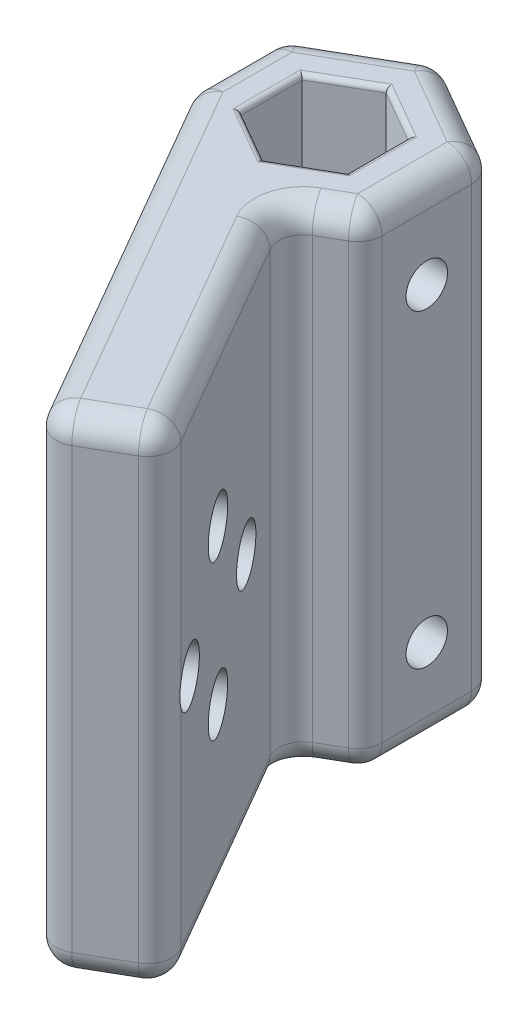
from build123d import *

# Parameters (mm, degrees)
BOSS_EXTRUDE1_DEPTH            = 30
CBORE_FOR_M3_SHCS1_D           = 3.4
CBORE_FOR_M3_SHCS1_CBORE_D     = 6.5
CBORE_FOR_M3_SHCS1_CBORE_DEPTH = 3
F_10_CLEARANCE_HOLE1_D         = 5.1054
FILLET1_R                      = 3
FILLET2_R                      = 0.6


with BuildPart() as part:
    # Sketch1 → Boss-Extrude1 (new, symmetric)
    with BuildSketch(Plane(origin=(0, 0, 0), x_dir=(1, 0, 0), z_dir=(0, 1, 0))):
        Polygon((-4.775, -17.248339292), (13.225, -48.425253828), (23.617304845, -42.425253828), (5.617304845, -11.248339292), (12.55, -7.245745878), (12.55, 7.245745878), (0, 14.491491757), (-12.55, 7.245745878), (-12.55, -3.781644263), align=None)
        Polygon((6.55, -3.781644263), (6.55, 3.781644263), (0, 7.563288526), (-6.55, 3.781644263), (-6.55, -3.781644263), (0, -7.563288526), align=None, mode=Mode.SUBTRACT)
    extrude(amount=BOSS_EXTRUDE1_DEPTH, both=True)

    # CBORE for M3 SHCS1 (through all)
    with Locations(Plane(origin=(-0.657695155, 0, 0.379720475), x_dir=(-0.5000000000000012, 0, -0.866025403784438), z_dir=(0.8660254037844379, 0, -0.5000000000000011))):
        with Locations((-33.05, 9.5), (-42.55, 0), (-23.55, 0), (-33.05, -9.5)):
            CounterBoreHole(CBORE_FOR_M3_SHCS1_D / 2, CBORE_FOR_M3_SHCS1_CBORE_D / 2, CBORE_FOR_M3_SHCS1_CBORE_DEPTH)

    # #10 Clearance Hole1 (through all)
    with Locations(Plane(origin=(12.55, 0, 0), x_dir=(0, 0, -1), z_dir=(1, 0, 0))):
        with Locations((0, -19.05), (0, 19.05)):
            Hole(F_10_CLEARANCE_HOLE1_D / 2)

    # Fillet1
    # the kernel refuses this fillet: 3 mm, written as the material it adds along each edge
    with BuildSketch(Plane(origin=(5.617304845, -30, 11.248339292), x_dir=(0.5000000000000009, 0, 0.8660254037844382), z_dir=(0, 1, 0))) as fillet1_piece_1:
        with BuildLine():
            CenterArc((FILLET1_R, FILLET1_R), FILLET1_R, 180, 90)
            Line((0, FILLET1_R), (0, 0))
            Line((0, 0), (FILLET1_R, 0))
        make_face()
    extrude(amount=60)
    # the kernel refuses this fillet: 3 mm, written as the material it takes off along each edge
    with BuildSketch(Plane(origin=(-9.55, -27, -5.513695071), x_dir=(-1, 0, 0), z_dir=(0, -1, 0))) as fillet1_2_piece_1_section:
        Polygon((0, 0), (FILLET1_R, 0), (FILLET1_R, FILLET1_R * 0.57735026919), (FILLET1_R * 0.5, FILLET1_R * 0.866025403784), align=None)
    fillet1_2_piece_1 = extrude(amount=FILLET1_R, mode=Mode.PRIVATE)
    fillet1_2_piece_1 = fillet1_2_piece_1 - Plane(origin=(-9.55, -27, -5.513695071), x_dir=(0.8660254037844387, 0, 0.5000000000000001), z_dir=(0, -1, 0)) * Sphere(FILLET1_R, mode=Mode.PRIVATE)
    add(fillet1_2_piece_1, mode=Mode.SUBTRACT)
    with BuildSketch(Plane(origin=(-9.55, -27, 2.977796686), x_dir=(-1, 0, 0), z_dir=(0, -1, 0))) as fillet1_2_piece_2_section:
        Polygon((0, 0), (FILLET1_R, 0), (FILLET1_R, -FILLET1_R * 0.267949192431), (FILLET1_R * 0.866025403784, -FILLET1_R * 0.5), align=None)
    fillet1_2_piece_2 = extrude(amount=FILLET1_R, mode=Mode.PRIVATE)
    fillet1_2_piece_2 = fillet1_2_piece_2 - Plane(origin=(-9.55, -27, 2.977796686), x_dir=(0.9659258262890681, 0, -0.25881904510252146), z_dir=(0, -1, 0)) * Sphere(FILLET1_R, mode=Mode.PRIVATE)
    add(fillet1_2_piece_2, mode=Mode.SUBTRACT)
    with BuildSketch(Plane(origin=(0, -27, -11.027390142), x_dir=(0.5000000000000001, 0, -0.8660254037844387), z_dir=(0, -1, 0))) as fillet1_2_piece_3_section:
        Polygon((0, 0), (FILLET1_R, 0), (FILLET1_R, -FILLET1_R * 0.57735026919), (FILLET1_R * 0.5, -FILLET1_R * 0.866025403784), align=None)
    fillet1_2_piece_3 = extrude(amount=FILLET1_R, mode=Mode.PRIVATE)
    fillet1_2_piece_3 = fillet1_2_piece_3 - Plane(origin=(0, -27, -11.027390142), x_dir=(0, 0, 1), z_dir=(0, -1, 0)) * Sphere(FILLET1_R, mode=Mode.PRIVATE)
    add(fillet1_2_piece_3, mode=Mode.SUBTRACT)
    with BuildSketch(Plane(origin=(9.55, -27, -5.513695071), x_dir=(1, 0, 0), z_dir=(0, -1, 0))) as fillet1_2_piece_4_section:
        Polygon((0, 0), (FILLET1_R, 0), (FILLET1_R, -FILLET1_R * 0.57735026919), (FILLET1_R * 0.5, -FILLET1_R * 0.866025403784), align=None)
    fillet1_2_piece_4 = extrude(amount=FILLET1_R, mode=Mode.PRIVATE)
    fillet1_2_piece_4 = fillet1_2_piece_4 - Plane(origin=(9.55, -27, -5.513695071), x_dir=(-0.8660254037844387, 0, 0.5000000000000001), z_dir=(0, -1, 0)) * Sphere(FILLET1_R, mode=Mode.PRIVATE)
    add(fillet1_2_piece_4, mode=Mode.SUBTRACT)
    with BuildSketch(Plane(origin=(9.55, -27, 5.513695071), x_dir=(1, 0, 0), z_dir=(0, -1, 0))) as fillet1_2_piece_5_section:
        Polygon((0, 0), (FILLET1_R, 0), (FILLET1_R, FILLET1_R * 0.57735026919), (FILLET1_R * 0.5, FILLET1_R * 0.866025403784), align=None)
    fillet1_2_piece_5 = extrude(amount=FILLET1_R, mode=Mode.PRIVATE)
    fillet1_2_piece_5 = fillet1_2_piece_5 - Plane(origin=(9.55, -27, 5.513695071), x_dir=(-0.8660254037844387, 0, -0.5000000000000001), z_dir=(0, -1, 0)) * Sphere(FILLET1_R, mode=Mode.PRIVATE)
    add(fillet1_2_piece_5, mode=Mode.SUBTRACT)
    with BuildSketch(Plane(origin=(19.519228634, -27, 41.327177617), x_dir=(0, -1, 0), z_dir=(0.866025403784438, 0, -0.5000000000000012))) as fillet1_2_piece_6_section:
        Polygon((0, 0), (FILLET1_R, 0), (FILLET1_R, -FILLET1_R), (0, -FILLET1_R), align=None)
    fillet1_2_piece_6 = extrude(amount=FILLET1_R, mode=Mode.PRIVATE)
    fillet1_2_piece_6 = fillet1_2_piece_6 - Plane(origin=(19.519228634, -27, 41.327177617), x_dir=(-0.3535533905932746, 0.7071067811865475, -0.612372435695794), z_dir=(0.866025403784438, 0, -0.5000000000000012)) * Sphere(FILLET1_R, mode=Mode.PRIVATE)
    add(fillet1_2_piece_6, mode=Mode.SUBTRACT)
    with BuildSketch(Plane(origin=(14.323076211, -27, 44.327177617), x_dir=(0.5000000000000012, 0, 0.866025403784438), z_dir=(-0.8660254037844379, 0, 0.5000000000000012))) as fillet1_2_piece_7_section:
        Polygon((0, 0), (FILLET1_R, 0), (FILLET1_R, -FILLET1_R), (0, -FILLET1_R), align=None)
    fillet1_2_piece_7 = extrude(amount=FILLET1_R, mode=Mode.PRIVATE)
    fillet1_2_piece_7 = fillet1_2_piece_7 - Plane(origin=(14.323076211, -27, 44.327177617), x_dir=(-0.3535533905932746, 0.7071067811865475, -0.612372435695794), z_dir=(-0.8660254037844379, 0, 0.5000000000000012)) * Sphere(FILLET1_R, mode=Mode.PRIVATE)
    add(fillet1_2_piece_7, mode=Mode.SUBTRACT)
    with BuildSketch(Plane(origin=(9.55, 27, 5.513695071), x_dir=(1, 0, 0), z_dir=(0, 1, 0))) as fillet1_2_piece_8_section:
        Polygon((0, 0), (FILLET1_R, 0), (FILLET1_R, -FILLET1_R * 0.57735026919), (FILLET1_R * 0.5, -FILLET1_R * 0.866025403784), align=None)
    fillet1_2_piece_8 = extrude(amount=FILLET1_R, mode=Mode.PRIVATE)
    fillet1_2_piece_8 = fillet1_2_piece_8 - Plane(origin=(9.55, 27, 5.513695071), x_dir=(-0.8660254037844387, 0, -0.5000000000000001), z_dir=(0, 1, 0)) * Sphere(FILLET1_R, mode=Mode.PRIVATE)
    add(fillet1_2_piece_8, mode=Mode.SUBTRACT)
    with BuildSketch(Plane(origin=(14.323076211, 27, 44.327177617), x_dir=(0.5000000000000012, 0, 0.866025403784438), z_dir=(-0.8660254037844379, 0, 0.5000000000000012))) as fillet1_2_piece_9_section:
        Polygon((0, 0), (FILLET1_R, 0), (FILLET1_R, FILLET1_R), (0, FILLET1_R), align=None)
    fillet1_2_piece_9 = extrude(amount=FILLET1_R, mode=Mode.PRIVATE)
    fillet1_2_piece_9 = fillet1_2_piece_9 - Plane(origin=(14.323076211, 27, 44.327177617), x_dir=(-0.3535533905932746, -0.7071067811865475, -0.612372435695794), z_dir=(-0.8660254037844379, 0, 0.5000000000000012)) * Sphere(FILLET1_R, mode=Mode.PRIVATE)
    add(fillet1_2_piece_9, mode=Mode.SUBTRACT)
    with BuildSketch(Plane(origin=(-9.55, 27, 2.977796686), x_dir=(-1, 0, 0), z_dir=(0, 1, 0))) as fillet1_2_piece_10_section:
        Polygon((0, 0), (FILLET1_R, 0), (FILLET1_R, FILLET1_R * 0.267949192431), (FILLET1_R * 0.866025403784, FILLET1_R * 0.5), align=None)
    fillet1_2_piece_10 = extrude(amount=FILLET1_R, mode=Mode.PRIVATE)
    fillet1_2_piece_10 = fillet1_2_piece_10 - Plane(origin=(-9.55, 27, 2.977796686), x_dir=(0.9659258262890681, 0, -0.25881904510252146), z_dir=(0, 1, 0)) * Sphere(FILLET1_R, mode=Mode.PRIVATE)
    add(fillet1_2_piece_10, mode=Mode.SUBTRACT)
    with BuildSketch(Plane(origin=(-9.55, 27, -5.513695071), x_dir=(-1, 0, 0), z_dir=(0, 1, 0))) as fillet1_2_piece_11_section:
        Polygon((0, 0), (FILLET1_R, 0), (FILLET1_R, -FILLET1_R * 0.57735026919), (FILLET1_R * 0.5, -FILLET1_R * 0.866025403784), align=None)
    fillet1_2_piece_11 = extrude(amount=FILLET1_R, mode=Mode.PRIVATE)
    fillet1_2_piece_11 = fillet1_2_piece_11 - Plane(origin=(-9.55, 27, -5.513695071), x_dir=(0.8660254037844387, 0, 0.5000000000000001), z_dir=(0, 1, 0)) * Sphere(FILLET1_R, mode=Mode.PRIVATE)
    add(fillet1_2_piece_11, mode=Mode.SUBTRACT)
    with BuildSketch(Plane(origin=(0, 27, -11.027390142), x_dir=(0.5000000000000001, 0, -0.8660254037844387), z_dir=(0, 1, 0))) as fillet1_2_piece_12_section:
        Polygon((0, 0), (FILLET1_R, 0), (FILLET1_R, FILLET1_R * 0.57735026919), (FILLET1_R * 0.5, FILLET1_R * 0.866025403784), align=None)
    fillet1_2_piece_12 = extrude(amount=FILLET1_R, mode=Mode.PRIVATE)
    fillet1_2_piece_12 = fillet1_2_piece_12 - Plane(origin=(0, 27, -11.027390142), x_dir=(0, 0, 1), z_dir=(0, 1, 0)) * Sphere(FILLET1_R, mode=Mode.PRIVATE)
    add(fillet1_2_piece_12, mode=Mode.SUBTRACT)
    with BuildSketch(Plane(origin=(9.55, 27, -5.513695071), x_dir=(1, 0, 0), z_dir=(0, 1, 0))) as fillet1_2_piece_13_section:
        Polygon((0, 0), (FILLET1_R, 0), (FILLET1_R, FILLET1_R * 0.57735026919), (FILLET1_R * 0.5, FILLET1_R * 0.866025403784), align=None)
    fillet1_2_piece_13 = extrude(amount=FILLET1_R, mode=Mode.PRIVATE)
    fillet1_2_piece_13 = fillet1_2_piece_13 - Plane(origin=(9.55, 27, -5.513695071), x_dir=(-0.8660254037844387, 0, 0.5000000000000001), z_dir=(0, 1, 0)) * Sphere(FILLET1_R, mode=Mode.PRIVATE)
    add(fillet1_2_piece_13, mode=Mode.SUBTRACT)
    with BuildSketch(Plane(origin=(19.519228634, 27, 41.327177617), x_dir=(0, 1, 0), z_dir=(0.5000000000000012, 0, 0.866025403784438))) as fillet1_2_piece_14_section:
        Polygon((0, 0), (FILLET1_R, 0), (FILLET1_R, -FILLET1_R), (0, -FILLET1_R), align=None)
    fillet1_2_piece_14 = extrude(amount=FILLET1_R, mode=Mode.PRIVATE)
    fillet1_2_piece_14 = fillet1_2_piece_14 - Plane(origin=(19.519228634, 27, 41.327177617), x_dir=(-0.612372435695794, -0.7071067811865475, 0.3535533905932746), z_dir=(0.5000000000000012, 0, 0.866025403784438)) * Sphere(FILLET1_R, mode=Mode.PRIVATE)
    add(fillet1_2_piece_14, mode=Mode.SUBTRACT)
    with BuildSketch(Plane(origin=(-12.55, -30, -5.513695071), x_dir=(1, 0, 0), z_dir=(0, 0, 1))) as fillet1_2_piece_15:
        with BuildLine():
            CenterArc((FILLET1_R, FILLET1_R), FILLET1_R, 180, 90)
            Line((0, FILLET1_R), (0, 0))
            Line((0, 0), (FILLET1_R, 0))
        make_face()
    extrude(amount=8.491491757, mode=Mode.SUBTRACT)
    with BuildSketch(Plane(origin=(-1.5, -30, -13.625466353), x_dir=(0.5000000000000001, 0, 0.8660254037844386), z_dir=(-0.8660254037844387, 0, 0.5000000000000001)), Plane(origin=(11.05, -30, -8.111771282), x_dir=(-0.5, 0, 0.8660254037844386), z_dir=(-0.8660254037844387, 0, -0.5000000000000001)), Plane(origin=(12.55, -30, 5.513695071), x_dir=(-1, 0, 0), z_dir=(0, 0, -1))) as fillet1_2_piece_16:
        with BuildLine():
            CenterArc((FILLET1_R, FILLET1_R), FILLET1_R, 180, 90)
            Line((0, FILLET1_R), (0, 0))
            Line((0, 0), (FILLET1_R, 0))
        make_face()
    extrude(amount=11.027390142, mode=Mode.SUBTRACT)
    with BuildSketch(Plane(origin=(8.215381057, -30, 9.748339292), x_dir=(-0.5, 0, -0.8660254037844386), z_dir=(0.8660254037844387, 0, -0.5000000000000001))) as fillet1_2_piece_17:
        with BuildLine():
            CenterArc((FILLET1_R, FILLET1_R), FILLET1_R, 180, 90)
            Line((0, FILLET1_R), (0, 0))
            Line((0, 0), (FILLET1_R, 0))
        make_face()
    extrude(amount=3.27313602, mode=Mode.SUBTRACT)
    with BuildSketch(Plane(origin=(22.117304845, -30, 39.827177617), x_dir=(-0.8660254037844379, 0, 0.5000000000000012), z_dir=(-0.5000000000000012, 0, -0.866025403784438))) as fillet1_2_piece_18:
        with BuildLine():
            CenterArc((FILLET1_R, FILLET1_R), FILLET1_R, 180, 90)
            Line((0, FILLET1_R), (0, 0))
            Line((0, 0), (FILLET1_R, 0))
        make_face()
    extrude(amount=30, mode=Mode.SUBTRACT)
    with BuildSketch(Plane(origin=(15.823076211, -30, 46.925253828), x_dir=(0, 1, 0), z_dir=(0.866025403784438, 0, -0.5000000000000012))) as fillet1_2_piece_19:
        with BuildLine():
            CenterArc((FILLET1_R, -FILLET1_R), FILLET1_R, 90, 90)
            Line((0, -FILLET1_R), (0, 0))
            Line((0, 0), (FILLET1_R, 0))
        make_face()
    extrude(amount=6, mode=Mode.SUBTRACT)
    with BuildSketch(Plane(origin=(8.215381057, 30, 9.748339292), x_dir=(-0.5, 0, -0.8660254037844386), z_dir=(0.8660254037844387, 0, -0.5000000000000001))) as fillet1_2_piece_20:
        with BuildLine():
            CenterArc((FILLET1_R, -FILLET1_R), FILLET1_R, 90, 90)
            Line((0, -FILLET1_R), (0, 0))
            Line((0, 0), (FILLET1_R, 0))
        make_face()
    extrude(amount=3.27313602, mode=Mode.SUBTRACT)
    with BuildSketch(Plane(origin=(13.225, -27, 48.425253828), x_dir=(-0.5000000000000022, 0, -0.8660254037844374), z_dir=(0, 1, 0)), Plane(origin=(23.617304845, -27, 42.425253828), x_dir=(-0.8660254037844379, 0, 0.500000000000001), z_dir=(0, 1, 0))) as fillet1_2_piece_21:
        with BuildLine():
            CenterArc((FILLET1_R, -FILLET1_R), FILLET1_R, 90, 90)
            Line((0, -FILLET1_R), (0, 0))
            Line((0, 0), (FILLET1_R, 0))
        make_face()
    extrude(amount=54, mode=Mode.SUBTRACT)
    with BuildSketch(Plane(origin=(-12.55, 27, 3.781644263), x_dir=(0.49999999999999556, 0, 0.8660254037844412), z_dir=(0, -1, 0))) as fillet1_2_piece_22:
        with BuildLine():
            CenterArc((FILLET1_R * 0.267949192431, -FILLET1_R), FILLET1_R, 90, 30)
            Line((-FILLET1_R * 0.232050807569, -FILLET1_R * 0.133974596216), (0, 0))
            Line((0, 0), (FILLET1_R * 0.267949192431, 0))
        make_face()
    extrude(amount=54, mode=Mode.SUBTRACT)
    with BuildSketch(Plane(origin=(-12.55, 27, -7.245745878), x_dir=(0, 0, 1), z_dir=(0, -1, 0)), Plane(origin=(0, -27, -14.491491757), x_dir=(0.8660254037844387, 0, 0.49999999999999994), z_dir=(0, 1, 0)), Plane(origin=(12.55, -27, -7.245745878), x_dir=(0, 0, 1), z_dir=(0, 1, 0)), Plane(origin=(12.55, -27, 7.245745878), x_dir=(-0.8660254037844385, 0, 0.5000000000000002), z_dir=(0, 1, 0))) as fillet1_2_piece_23:
        with BuildLine():
            CenterArc((FILLET1_R * 0.57735026919, -FILLET1_R), FILLET1_R, 90, 60)
            Line((-FILLET1_R * 0.288675134595, -FILLET1_R * 0.5), (0, 0))
            Line((0, 0), (FILLET1_R * 0.57735026919, 0))
        make_face()
    extrude(amount=54, mode=Mode.SUBTRACT)
    with BuildSketch(Plane(origin=(12.55, 30, 5.513695071), x_dir=(-1, 0, 0), z_dir=(0, 0, -1)), Plane(origin=(11.05, 30, -8.111771282), x_dir=(-0.5, 0, 0.8660254037844386), z_dir=(-0.8660254037844387, 0, -0.5000000000000001)), Plane(origin=(-1.5, 30, -13.625466353), x_dir=(0.5000000000000001, 0, 0.8660254037844386), z_dir=(-0.8660254037844387, 0, 0.5000000000000001))) as fillet1_2_piece_24:
        with BuildLine():
            CenterArc((FILLET1_R, -FILLET1_R), FILLET1_R, 90, 90)
            Line((0, -FILLET1_R), (0, 0))
            Line((0, 0), (FILLET1_R, 0))
        make_face()
    extrude(amount=11.027390142, mode=Mode.SUBTRACT)
    with BuildSketch(Plane(origin=(-12.55, 30, -5.513695071), x_dir=(1, 0, 0), z_dir=(0, 0, 1))) as fillet1_2_piece_25:
        with BuildLine():
            CenterArc((FILLET1_R, -FILLET1_R), FILLET1_R, 90, 90)
            Line((0, -FILLET1_R), (0, 0))
            Line((0, 0), (FILLET1_R, 0))
        make_face()
    extrude(amount=8.491491757, mode=Mode.SUBTRACT)
    with BuildSketch(Plane(origin=(11.725, 30, 45.827177617), x_dir=(0, -1, 0), z_dir=(-0.5000000000000012, 0, -0.866025403784438)), Plane(origin=(-12.148076211, -30, 4.477796686), x_dir=(0, 1, 0), z_dir=(0.5000000000000012, 0, 0.866025403784438))) as fillet1_2_piece_26:
        with BuildLine():
            CenterArc((FILLET1_R, -FILLET1_R), FILLET1_R, 90, 90)
            Line((0, -FILLET1_R), (0, 0))
            Line((0, 0), (FILLET1_R, 0))
        make_face()
    extrude(amount=47.746152423, mode=Mode.SUBTRACT)
    with BuildSketch(Plane(origin=(15.823076211, 30, 46.925253828), x_dir=(0, -1, 0), z_dir=(0.866025403784438, 0, -0.5000000000000012))) as fillet1_2_piece_27:
        with BuildLine():
            CenterArc((FILLET1_R, FILLET1_R), FILLET1_R, 180, 90)
            Line((0, FILLET1_R), (0, 0))
            Line((0, 0), (FILLET1_R, 0))
        make_face()
    extrude(amount=6, mode=Mode.SUBTRACT)
    with BuildSketch(Plane(origin=(22.117304845, 30, 39.827177617), x_dir=(-0.8660254037844379, 0, 0.5000000000000012), z_dir=(-0.5000000000000012, 0, -0.866025403784438))) as fillet1_2_piece_28:
        with BuildLine():
            CenterArc((FILLET1_R, -FILLET1_R), FILLET1_R, 90, 90)
            Line((0, -FILLET1_R), (0, 0))
            Line((0, 0), (FILLET1_R, 0))
        make_face()
    extrude(amount=30, mode=Mode.SUBTRACT)
    with BuildSketch(Plane(origin=(9.715381057, 30, 12.346415503), x_dir=(-0.8660254037844379, 0, 0.5000000000000011), z_dir=(0.5000000000000011, 0, 0.8660254037844379))) as fillet1_2_piece_29:
        with BuildLine():
            CenterArc((3 + FILLET1_R, FILLET1_R), FILLET1_R, 180, 90)
            Line((3, FILLET1_R), (3, 0))
            Line((3, 0), (3 + FILLET1_R, 0))
        make_face()
    revolve(axis=Axis((9.715381057, 30, 12.346415503), (0, -1, 0)), revolution_arc=90, mode=Mode.SUBTRACT)
    with BuildSketch(Plane(origin=(9.715381057, -30, 12.346415503), x_dir=(-0.8660254037844379, 0, 0.5000000000000011), z_dir=(0.5000000000000011, 0, 0.8660254037844379))) as fillet1_2_piece_30:
        with BuildLine():
            CenterArc((3 + FILLET1_R, -FILLET1_R), FILLET1_R, 90, 90)
            Line((3, -FILLET1_R), (3, 0))
            Line((3, 0), (3 + FILLET1_R, 0))
        make_face()
    revolve(axis=Axis((9.715381057, -30, 12.346415503), (0, -1, 0)), revolution_arc=90, mode=Mode.SUBTRACT)

    # Fillet2
    fillet2_edges = [part.edges().sort_by_distance(p)[0] for p in [
        (3.275, -30, 5.672466395),
        (6.55, -30, 0),
        (3.275, -30, -5.672466395),
        (-3.275, -30, -5.672466395),
        (-6.55, -30, 0),
        (-3.275, -30, 5.672466395),
        (3.275, 30, 5.672466395),
        (6.55, 30, 0),
        (3.275, 30, -5.672466395),
        (-3.275, 30, -5.672466395),
        (-6.55, 30, 0),
        (-3.275, 30, 5.672466395),
        (12.419228634, -9.5, 29.029616883),
        (7.669228634, 0, 20.802375547),
        (17.169228634, 0, 37.256858219),
        (12.419228634, 9.5, 29.029616883),
    ]]
    fillet(fillet2_edges, radius=FILLET2_R)


solid = part.part
